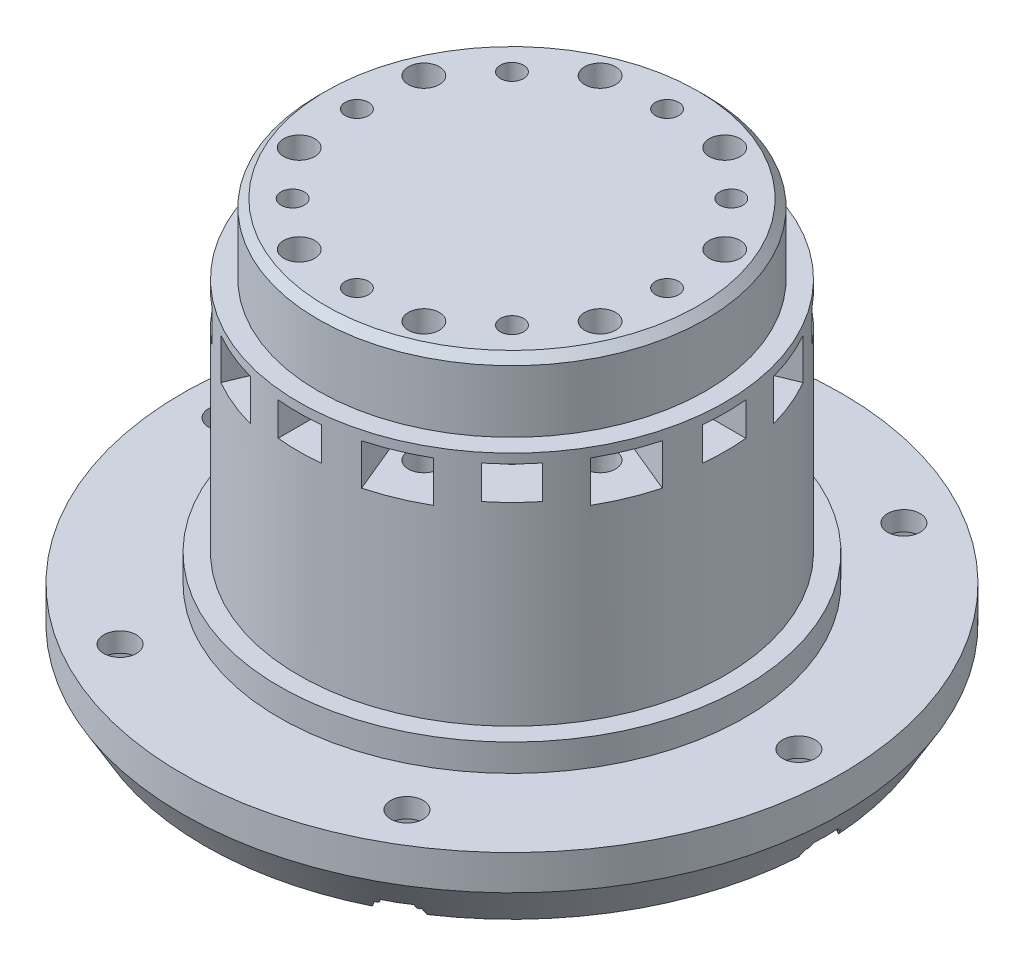
from build123d import *

# Parameters (mm, degrees)
SKETCH21_R          = 3.175
CUT_EXTRUDE13_DEPTH = 3.16
SKETCH18_R          = 2.1
CUT_EXTRUDE11_DEPTH = 80.804448498
CUT_EXTRUDE12_DEPTH = 7
SKETCH20_R          = 0.4
BOSS_EXTRUDE1_DEPTH = 2.5
CIRPATTERN1_COUNT   = 6
CHAMFER1_SIZE       = 2.886751346
CHAMFER1_SIZE_2     = 5
SKETCH22_R          = 1.5
SKETCH22_R_2        = 2
CUT_EXTRUDE14_DEPTH = 20
CUT_EXTRUDE15_START = -14.5
SKETCH23_R          = 1.5
CUT_EXTRUDE15_DEPTH = 4.5
CUT_EXTRUDE16_START = -15.5
SKETCH23_3_R        = 2
CUT_EXTRUDE16_DEPTH = 5.5
CIRPATTERN2_COUNT   = 8
CHAMFER3_SIZE       = 1
BOSS_EXTRUDE4_START = 0.2
SKETCH32_R          = 27.5
BOSS_EXTRUDE4_DEPTH = 0.2
SKETCH33_W          = 18
SKETCH33_H          = 1.5
CUT_EXTRUDE19_DEPTH = 5


with BuildPart() as part:
    # Sketch1 → Revolve1 (revolve)
    with BuildSketch(Plane.XY, mode=Mode.PRIVATE) as revolve1_sk:
        Polygon((0, 0), (-42.5, 0), (-42.5, 9.5), (-30, 9.5), (-30, 13), (0, 13), align=None)
    revolve(revolve1_sk.sketch.rotate(Axis((0, 0, 0), (0, 1, 0)), 270), axis=Axis((0, 0, 0), (0, 1, 0)))

    # Sketch2 → Revolve2 (revolve)
    with BuildSketch(Plane.XY, mode=Mode.PRIVATE) as revolve2_sk:
        Polygon((-27.5, 42.5), (-27.5, 13), (0, 13), (0, 42.5), (0, 52.5), (-25, 52.5), (-25, 43.5), (-27.5, 43.5), align=None)
        Polygon((0, -9), (-15, -9), (-15, -1), (-17.5, -1), (-17.5, 0), (0, 0), align=None)
    revolve(revolve2_sk.sketch.rotate(Axis((0, 0, 0), (0, 1, 0)), 270), axis=Axis((0, 0, 0), (0, 1, 0)))

    # Sketch21 → Cut-Extrude13 (cut)
    with BuildSketch(Plane.XZ.offset(9)):
        with Locations(Location((0, 0, 0), (0, 0, 270))):
            Circle(SKETCH21_R)
    extrude(amount=-CUT_EXTRUDE13_DEPTH, mode=Mode.SUBTRACT)

    # Sketch18 → Cut-Extrude11 (cut, through all)
    with BuildSketch(Plane.XZ):
        with Locations(Location((-37, 0, 0), (0, 0, 270))):
            Circle(SKETCH18_R)
        with Locations(Location((-18.5, 32.04293994, 0), (0, 0, 270))):
            Circle(SKETCH18_R)
        with Locations(Location((18.5, 32.04293994, 0), (0, 0, 270))):
            Circle(SKETCH18_R)
        with Locations(Location((37, 0, 0), (0, 0, 270))):
            Circle(SKETCH18_R)
        with Locations(Location((18.5, -32.04293994, 0), (0, 0, 270))):
            Circle(SKETCH18_R)
        with Locations(Location((-18.5, -32.04293994, 0), (0, 0, 270))):
            Circle(SKETCH18_R)
    extrude(amount=-CUT_EXTRUDE11_DEPTH, mode=Mode.SUBTRACT)

    # Sketch19 → Cut-Extrude12 (cut)
    with BuildSketch(Plane.XZ):
        Polygon((-33.5, -2.020725942), (-33.5, 2.020725942), (-37, 4.041451884), (-40.5, 2.020725942), (-40.5, -2.020725942), (-37, -4.041451884), align=None)
    cut_extrude12 = extrude(amount=-CUT_EXTRUDE12_DEPTH, mode=Mode.SUBTRACT)

    # Sketch20 → Boss-Extrude1 (add)
    with BuildSketch(Plane.XZ):
        with Locations((-40.5, 2.020725942)):
            Circle(SKETCH20_R)
        with Locations((-37, 4.041451884)):
            Circle(SKETCH20_R)
        with Locations((-33.5, 2.020725942)):
            Circle(SKETCH20_R)
        with Locations((-33.5, -2.020725942)):
            Circle(SKETCH20_R)
        with Locations((-37, -4.041451884)):
            Circle(SKETCH20_R)
        with Locations((-40.5, -2.020725942)):
            Circle(SKETCH20_R)
    boss_extrude1 = extrude(amount=-BOSS_EXTRUDE1_DEPTH)

    # CirPattern1: Cut-Extrude12, Boss-Extrude1 ×6 about axis
    cirpattern1_axis = Axis((0, 0, 0), (0, 1, 0))
    add([cut_extrude12.rotate(cirpattern1_axis, i * 360 / CIRPATTERN1_COUNT) for i in range(1, CIRPATTERN1_COUNT)], mode=Mode.SUBTRACT)
    add([boss_extrude1.rotate(cirpattern1_axis, i * 360 / CIRPATTERN1_COUNT) for i in range(1, CIRPATTERN1_COUNT)])

    # Chamfer1
    # the kernel refuses this chamfer: 5, 2.886751346 mm, written as the material it takes off along each edge
    with BuildSketch(Plane(origin=(0, 0, 0), x_dir=(0, 0, -1), z_dir=(1, 0, 0))) as chamfer1_piece_1:
        Polygon((42.5 - CHAMFER1_SIZE, 0), (42.5, CHAMFER1_SIZE_2), (42.5, 0), align=None)
    revolve(axis=Axis((0, 0, 0), (0, 1, 0)), mode=Mode.SUBTRACT)

    # Sketch22 → Cut-Extrude14 (cut)
    with BuildSketch(Plane(origin=(0, 52.5, 0), x_dir=(1, 0, 0), z_dir=(0, 1, 0))):
        with Locations(Location((0, 20, 0), (0, 0, 270))):
            Circle(SKETCH22_R)
        with Locations(Location((8.03635208, 19.401470183, 0), (0, 0, 270))):
            Circle(SKETCH22_R_2)
        with Locations(Location((14.142135624, 14.142135624, 0), (0, 0, 270))):
            Circle(SKETCH22_R)
        with Locations(Location((19.401470183, 8.03635208, 0), (0, 0, 270))):
            Circle(SKETCH22_R_2)
        with Locations(Location((20, 0, 0), (0, 0, 270))):
            Circle(SKETCH22_R)
        with Locations(Location((19.401470183, -8.03635208, 0), (0, 0, 270))):
            Circle(SKETCH22_R_2)
        with Locations(Location((14.142135624, -14.142135624, 0), (0, 0, 270))):
            Circle(SKETCH22_R)
        with Locations(Location((8.03635208, -19.401470183, 0), (0, 0, 270))):
            Circle(SKETCH22_R_2)
        with Locations(Location((0, -20, 0), (0, 0, 270))):
            Circle(SKETCH22_R)
        with Locations(Location((-8.03635208, -19.401470183, 0), (0, 0, 270))):
            Circle(SKETCH22_R_2)
        with Locations(Location((-14.142135624, -14.142135624, 0), (0, 0, 270))):
            Circle(SKETCH22_R)
        with Locations(Location((-19.401470183, -8.03635208, 0), (0, 0, 270))):
            Circle(SKETCH22_R_2)
        with Locations(Location((-20, 0, 0), (0, 0, 270))):
            Circle(SKETCH22_R)
        with Locations(Location((-19.401470183, 8.03635208, 0), (0, 0, 270))):
            Circle(SKETCH22_R_2)
        with Locations(Location((-14.142135624, 14.142135624, 0), (0, 0, 270))):
            Circle(SKETCH22_R)
        with Locations(Location((-8.03635208, 19.401470183, 0), (0, 0, 270))):
            Circle(SKETCH22_R_2)
    extrude(amount=-CUT_EXTRUDE14_DEPTH, mode=Mode.SUBTRACT)

    # Sketch23 → Cut-Extrude15 (cut)
    # profile 1 of 2: a face of its own
    with BuildSketch(Plane(origin=(0, 52.5, 0), x_dir=(1, 0, 0), z_dir=(0, 1, 0)).offset(CUT_EXTRUDE15_START)):
        with BuildLine():
            Line((-2.8, 24.842705167), (-2.8, 21.616580754))
            Line((-2.8, 21.616580754), (-2.8, 18.383419246))
            Line((-2.8, 18.383419246), (0, 16.766838493))
            Line((0, 16.766838493), (2.8, 18.383419246))
            Line((2.8, 18.383419246), (2.8, 21.616580754))
            Line((2.8, 21.616580754), (2.8, 24.842705167))
            ThreePointArc((2.8, 24.842705167), (0, 25), (-2.8, 24.842705167))
        make_face()
        with Locations(Location((0, 20, 0), (0, 0, 270))):
            Circle(SKETCH23_R, mode=Mode.SUBTRACT)
    # profile 2 of 2: a face of its own
    with BuildSketch(Plane(origin=(0, 52.5, 0), x_dir=(1, 0, 0), z_dir=(0, 1, 0)).offset(CUT_EXTRUDE15_START)):
        with BuildLine():
            Line((-2.8, 27.357083178), (-2.8, 24.842705167))
            ThreePointArc((-2.8, 24.842705167), (0, 25), (2.8, 24.842705167))
            Line((2.8, 24.842705167), (2.8, 27.357083178))
            ThreePointArc((2.8, 27.357083178), (0, 27.5), (-2.8, 27.357083178))
        make_face()
    cut_extrude15 = extrude(amount=CUT_EXTRUDE15_DEPTH, mode=Mode.SUBTRACT)

    # Sketch23<3> → Cut-Extrude16 (cut)
    # profile 1 of 2: a face of its own
    with BuildSketch(Plane(origin=(0, 52.5, 0), x_dir=(1, 0, 0), z_dir=(0, 1, 0)).offset(CUT_EXTRUDE16_START)):
        with BuildLine():
            ThreePointArc((12.749911594, 21.504412439), (9.567085809, 23.096988313), (6.190366913, 24.221464809))
            Line((6.190366913, 24.221464809), (5.540925198, 22.653573811))
            Line((5.540925198, 22.653573811), (3.972234281, 18.866418924))
            Line((3.972234281, 18.866418924), (6.467661163, 15.614315295))
            Line((6.467661163, 15.614315295), (10.531778962, 16.149366554))
            Line((10.531778962, 16.149366554), (12.100469879, 19.936521441))
            Line((12.100469879, 19.936521441), (12.749911594, 21.504412439))
        make_face()
        with Locations(Location((8.03635208, 19.401470183, 0), (0, 0, 270))):
            Circle(SKETCH23_3_R, mode=Mode.SUBTRACT)
    # profile 2 of 2: a face of its own
    with BuildSketch(Plane(origin=(0, 52.5, 0), x_dir=(1, 0, 0), z_dir=(0, 1, 0)).offset(CUT_EXTRUDE16_START)):
        with BuildLine():
            Line((7.155966971, 26.552629563), (6.190366913, 24.221464809))
            ThreePointArc((6.190366913, 24.221464809), (9.567085809, 23.096988313), (12.749911594, 21.504412439))
            Line((12.749911594, 21.504412439), (13.715511651, 23.835577193))
            ThreePointArc((13.715511651, 23.835577193), (10.52379439, 25.406687144), (7.155966971, 26.552629563))
        make_face()
    cut_extrude16 = extrude(amount=CUT_EXTRUDE16_DEPTH, mode=Mode.SUBTRACT)

    # CirPattern2: Cut-Extrude15, Cut-Extrude16 ×8 about axis
    cirpattern2_axis = Axis((0, 0, 0), (0, 1, 0))
    add([cut_extrude15.rotate(cirpattern2_axis, i * 360 / CIRPATTERN2_COUNT) for i in range(1, CIRPATTERN2_COUNT)], mode=Mode.SUBTRACT)
    add([cut_extrude16.rotate(cirpattern2_axis, i * 360 / CIRPATTERN2_COUNT) for i in range(1, CIRPATTERN2_COUNT)], mode=Mode.SUBTRACT)

    # Chamfer3
    chamfer3_edges = [part.edges().sort_by_distance(p)[0] for p in [
        (0, -9, 15),
        (0, 52.5, 25),
    ]]
    chamfer(chamfer3_edges, length=CHAMFER3_SIZE)

    # Sketch32 → Boss-Extrude4 (add)
    with BuildSketch(Plane.XZ.offset(-42.5).offset(BOSS_EXTRUDE4_START)):
        with Locations(Location((0, 0, 0), (0, 0, 270))):
            Circle(SKETCH32_R)
    extrude(amount=-BOSS_EXTRUDE4_DEPTH)

    # Sketch33 → Cut-Extrude19 (cut)
    with BuildSketch(Plane.XZ.offset(9)):
        Rectangle(SKETCH33_W, SKETCH33_H)
    extrude(amount=-CUT_EXTRUDE19_DEPTH, mode=Mode.SUBTRACT)


solid = part.part
